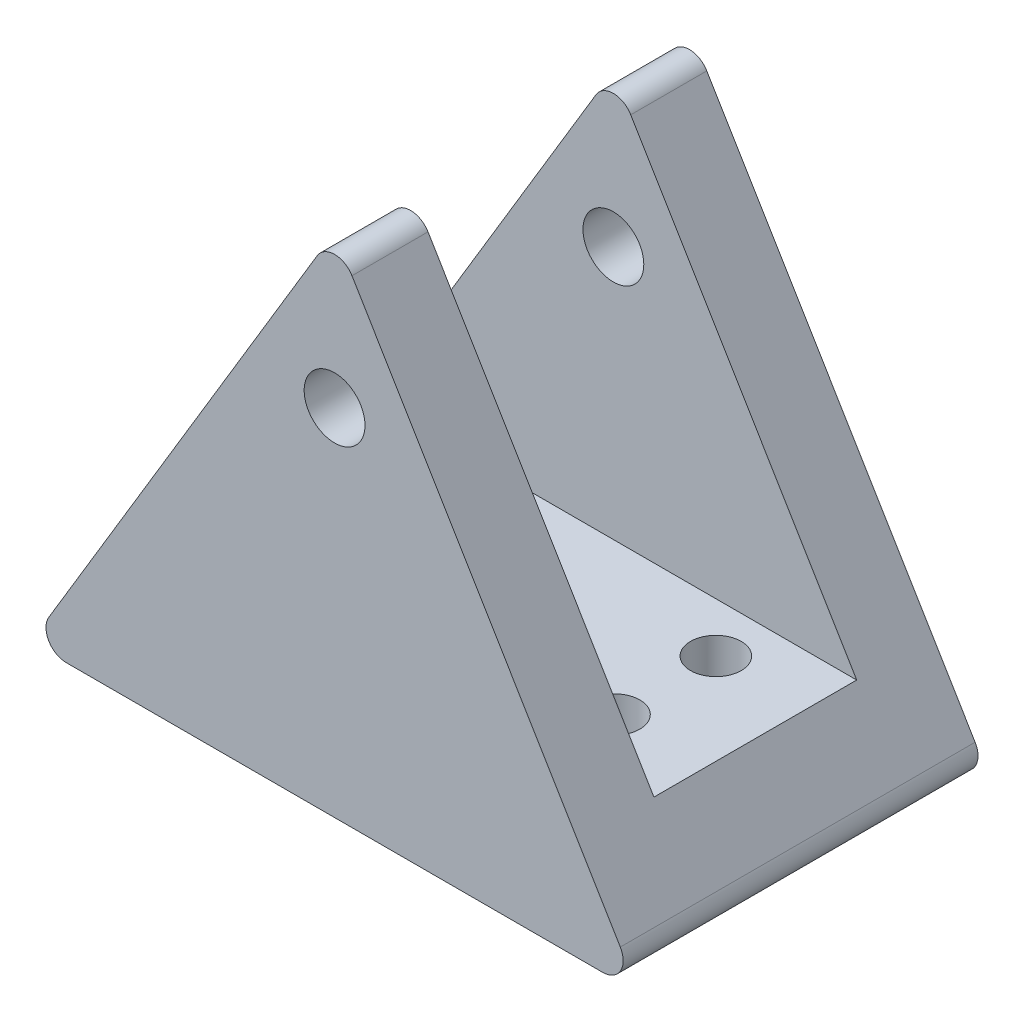
from build123d import *

# Parameters (mm, degrees)
SKETCH2_W           = 76.2
SKETCH2_H           = 63.5
BOSS_EXTRUDE1_DEPTH = 44.45
SKETCH5_W           = 25.4
SKETCH5_H           = 50.8
CUT_EXTRUDE3_DEPTH  = 94.756626432
CUT_EXTRUDE4_DEPTH  = 44.45
CUT_EXTRUDE5_DEPTH  = 67.599361859
SKETCH7_R           = 3.175
CUT_EXTRUDE6_DEPTH  = 44.45
SKETCH8_R           = 3.81
CUT_EXTRUDE7_DEPTH  = 67.599361859
FILLET3_R           = 2.54


with BuildPart() as part:
    # Sketch2 → Boss-Extrude1 (new body)
    with BuildSketch(Plane.XY):
        Rectangle(SKETCH2_W, SKETCH2_H)
    extrude(amount=BOSS_EXTRUDE1_DEPTH)

    # Sketch5 → Cut-Extrude3 (cut, through all)
    with BuildSketch(Plane(origin=(38.1, 0, 0), x_dir=(0, 0, -1), z_dir=(1, 0, 0))):
        with Locations((-22.225, 6.35)):
            Rectangle(SKETCH5_W, SKETCH5_H)
    extrude(amount=-CUT_EXTRUDE3_DEPTH, mode=Mode.SUBTRACT)

    # Sketch3 → Cut-Extrude4 (cut)
    with BuildSketch(Plane.XY.offset(44.45)):
        Polygon((-38.1, -31.75), (0, 31.75), (-38.1, 31.75), align=None)
    extrude(amount=-CUT_EXTRUDE4_DEPTH, mode=Mode.SUBTRACT)

    # Sketch6 → Cut-Extrude5 (cut, through all)
    with BuildSketch(Plane.XY.offset(44.45)):
        Polygon((0, 31.75), (38.1, -31.75), (38.1, 31.75), align=None)
    extrude(amount=-CUT_EXTRUDE5_DEPTH, mode=Mode.SUBTRACT)

    # Sketch7 → Cut-Extrude6 (cut)
    with BuildSketch(Plane(origin=(0, -19.05, 0), x_dir=(1, 0, 0), z_dir=(0, 1, 0))):
        with Locations((-19.05, -15.737033212)):
            Circle(SKETCH7_R)
        with Locations((19.05, -15.737033212)):
            Circle(SKETCH7_R)
        with Locations((19.05, -28.437033212)):
            Circle(SKETCH7_R)
        with Locations((-19.05, -28.437033212)):
            Circle(SKETCH7_R)
    extrude(amount=-CUT_EXTRUDE6_DEPTH, mode=Mode.SUBTRACT)

    # Sketch8 → Cut-Extrude7 (cut, through all)
    with BuildSketch(Plane.XY.offset(44.45)):
        with Locations((0, 12.7)):
            Circle(SKETCH8_R)
    extrude(amount=-CUT_EXTRUDE7_DEPTH, mode=Mode.SUBTRACT)

    # Fillet3
    fillet3_edges = [part.edges().sort_by_distance(p)[0] for p in [
        (38.1, -31.75, 22.225),
        (0, 31.75, 39.6875),
        (0, 31.75, 4.7625),
        (-38.1, -31.75, 22.225),
    ]]
    fillet(fillet3_edges, radius=FILLET3_R)


solid = part.part
